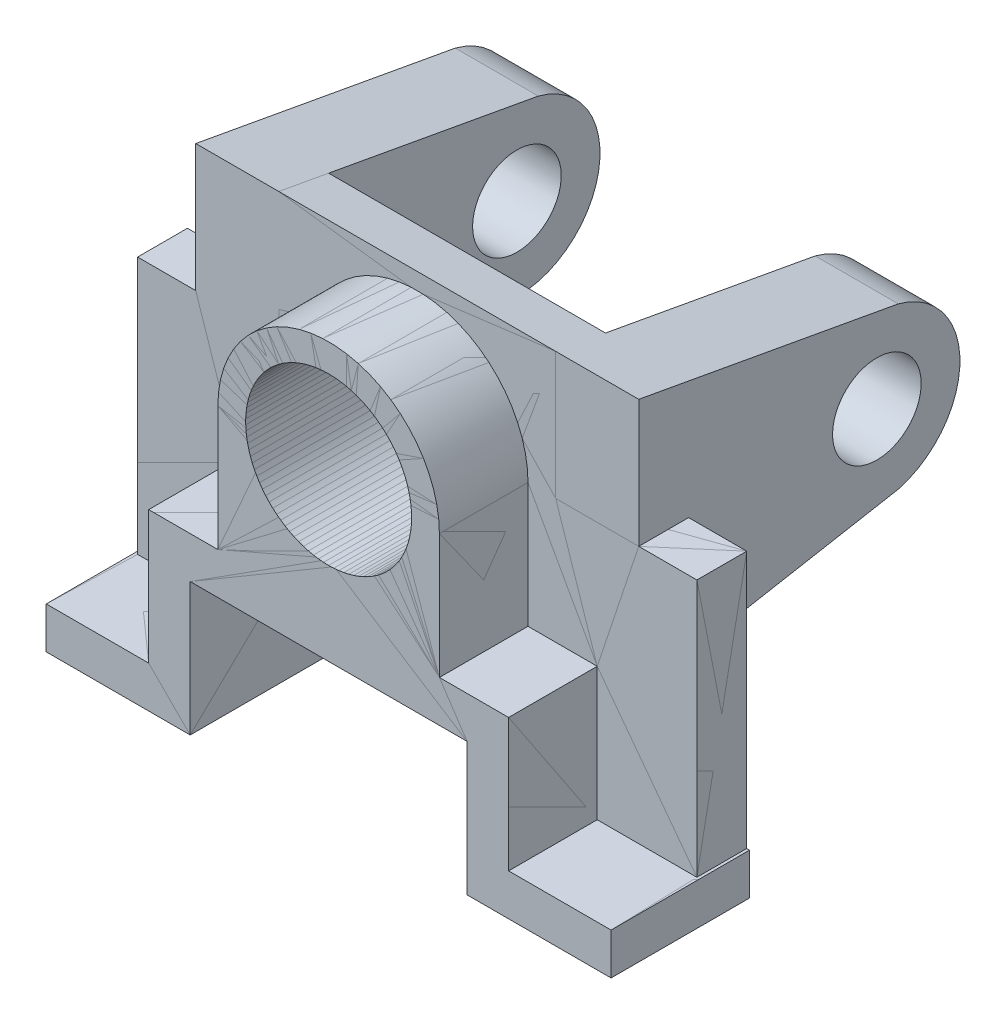
from build123d import *
from build123d.topology import SkipClean

# Parameters (mm, degrees)
BOSS_EXTRUDE1_DEPTH      = 18
BOSS_EXTRUDE2_DEPTH      = 32
BOSS_EXTRUDE2_DEPTH_BACK = 18
SKETCH2_R                = 30
CUT_EXTRUDE2_DEPTH       = 244.598029549
CUT_EXTRUDE2_DEPTH_BACK  = 244.598029549
SKETCH6_W                = 18
SKETCH6_H                = 46
SKETCH4_R                = 16
BOSS_EXTRUDE3_DEPTH      = 30
LOFT1_START              = 30
LOFT1_DEPTH              = 100
BOSS_EXTRUDE4_DEPTH      = 30
SKETCH14_R               = 30
CUT_EXTRUDE3_DEPTH       = 252.475644944


# Read off the part's stored shape, not the designer's step: Loft1
with BuildPart() as part:
    # Sketch1 → Boss-Extrude1 (new body)
    with BuildSketch(Plane.XY):
        with BuildLine():
            Line((0, 0), (160, 0))
            Line((160, 0), (160, -46))
            Line((160, -46), (181, -46))
            Line((181, -46), (181, -139))
            Line((181, -139), (145, -139))
            Line((145, -139), (145, -91))
            Line((145, -91), (120, -91))
            Line((120, -91), (120, -46))
            ThreePointArc((120, -46), (80, -6), (40, -46))
            Line((40, -46), (40, -91))
            Line((40, -91), (15, -91))
            Line((15, -91), (15, -139))
            Line((15, -139), (-21, -139))
            Line((-21, -139), (-21, -46))
            Line((-21, -46), (0, -46))
            Line((0, -46), (0, 0))
        make_face()
    extrude(amount=BOSS_EXTRUDE1_DEPTH)

    # Sketch2 → Boss-Extrude2 (add, two sides: drawn at the far end of the back side and taken through both)
    with BuildSketch(Plane.XY.offset(18).offset(-BOSS_EXTRUDE2_DEPTH_BACK)):
        with BuildLine():
            Line((15, -139), (-22, -139))
            Line((-22, -139), (-22, -154))
            Line((-22, -154), (30, -154))
            Line((30, -154), (30, -106))
            Line((30, -106), (130, -106))
            Line((130, -106), (130, -154))
            Line((130, -154), (182, -154))
            Line((182, -154), (182, -139))
            Line((182, -139), (145, -139))
            Line((145, -139), (145, -91))
            Line((145, -91), (120, -91))
            Line((120, -91), (120, -46))
            ThreePointArc((120, -46), (80, -6), (40, -46))
            Line((40, -46), (40, -91))
            Line((40, -91), (15, -91))
            Line((15, -91), (15, -139))
        make_face()
        with Locations((80, -46)):
            Circle(SKETCH2_R, mode=Mode.SUBTRACT)
    extrude(amount=BOSS_EXTRUDE2_DEPTH + BOSS_EXTRUDE2_DEPTH_BACK)

    # Sketch6 → Cut-Extrude2 (cut, two sides: drawn at the far end of the back side and taken through both)
    with BuildSketch(Plane(origin=(160, 0, 0), x_dir=(0, 0, -1), z_dir=(1, 0, 0)).offset(-CUT_EXTRUDE2_DEPTH_BACK)):
        with Locations((-9, -23)):
            Rectangle(SKETCH6_W, SKETCH6_H)
    extrude(amount=CUT_EXTRUDE2_DEPTH + CUT_EXTRUDE2_DEPTH_BACK, mode=Mode.SUBTRACT)

    # Sketch4 → Boss-Extrude3 (add)
    # profile 1 of 2: a face of its own
    with BuildSketch(Plane.ZY):
        with BuildLine():
            Line((-70.946033736, -75.854997659), (18, -92))
            Line((18, -92), (18, -46))
            Line((18, -46), (0, -46))
            Line((0, -46), (0, -3.267262518))
            Line((0, -3.267262518), (-70.946033736, -16.145002341))
            Line((-70.946033736, -16.145002341), (-75.734435176, -17.014167038))
            ThreePointArc((-75.734435176, -17.014167038), (-98, -46), (-75.734435176, -74.985832962))
            Line((-75.734435176, -74.985832962), (-70.946033736, -75.854997659))
        make_face()
        with Locations(Location((-68, -46, 0), (0, 0, 270))):
            Circle(SKETCH4_R, mode=Mode.SUBTRACT)
    # profile 2 of 2: a face of its own
    with BuildSketch(Plane.ZY):
        Polygon((0, -46), (18, -46), (18, 0), (0, -3.267262518), align=None)
    extrude(amount=-BOSS_EXTRUDE3_DEPTH)

    # Loft1 outline → Loft1 (add)
    with BuildSketch(Plane.YZ.offset(LOFT1_START)):
        Polygon((-46, 0), (-3.267262518, 0), (0, 18), (-46, 18), align=None)
    extrude(amount=LOFT1_DEPTH)


with BuildPart() as body_2:
    # Sketch13 → Boss-Extrude4 (new body)
    with BuildSketch(Plane(origin=(0, 0, 0), x_dir=(-1, 0, 0), z_dir=(0, 0, -1))):
        with BuildLine():
            Line((-80, -46), (-80, -76))
            ThreePointArc((-80, -76), (-58.786796564, -67.213203436), (-50, -46))
            Line((-50, -46), (-80, -46))
        make_face()
    extrude(amount=BOSS_EXTRUDE4_DEPTH)


with BuildPart() as body_3:
    # Mirror6: mirrored copy
    add(part.part.mirror(Plane(origin=(80, -46, -30), x_dir=(0, 0, 1), z_dir=(-1, 0, 0))))


with BuildPart() as cut_extrude3_tool:
    # Sketch14 → Cut-Extrude3 (new, through all)
    with SkipClean():  # the faces are left unmerged after this step: merging them gives an invalid solid
        with BuildSketch(Plane(origin=(0, 0, -30), x_dir=(-1, 0, 0), z_dir=(0, 0, -1))):
            with Locations((-80, -46)):
                Circle(SKETCH14_R)
        extrude(amount=-CUT_EXTRUDE3_DEPTH)


with BuildPart() as part_1:
    with SkipClean():  # the faces are left unmerged after this step: merging them gives an invalid solid
        add(part.part)

        # Cut-Extrude3: cut by cut_extrude3_tool
        add(cut_extrude3_tool.part, mode=Mode.SUBTRACT)


with BuildPart() as body_2_1:
    with SkipClean():  # the faces are left unmerged after this step: merging them gives an invalid solid
        add(body_2.part)

        # Cut-Extrude3: cut by cut_extrude3_tool
        add(cut_extrude3_tool.part, mode=Mode.SUBTRACT)


with BuildPart() as body_3_1:
    with SkipClean():  # the faces are left unmerged after this step: merging them gives an invalid solid
        add(body_3.part)

        # Cut-Extrude3: cut by cut_extrude3_tool
        add(cut_extrude3_tool.part, mode=Mode.SUBTRACT)


solid = Compound([part_1.part, body_3_1.part])
